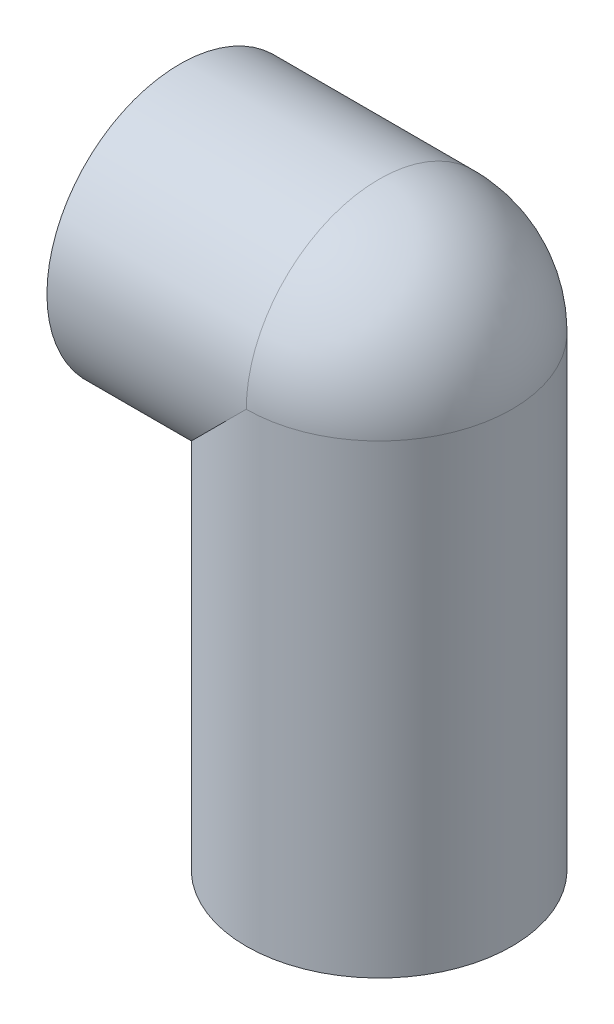
from build123d import *

# Parameters (mm, degrees)
BOSS_EXTRUDE1_DEPTH = 90
FILLET1_R           = 20
SKETCH3_R           = 20
BOSS_EXTRUDE2_DEPTH = 30
BOSS_EXTRUDE3_DEPTH = 70


with BuildPart() as part:
    # Sketch1 → Boss-Extrude1 (new body)
    with BuildSketch(Plane(origin=(0, 110, 0), x_dir=(1, 0, 0), z_dir=(0, 1, 0))):
        with BuildLine():
            Line((60, 20), (60, -20))
            ThreePointArc((60, -20), (80, 0), (60, 20))
        make_face()
    extrude(amount=BOSS_EXTRUDE1_DEPTH)

    # Fillet1
    fillet1_edges = [part.edges().sort_by_distance(p)[0] for p in [
        (80, 200, 0),
    ]]
    fillet(fillet1_edges, radius=FILLET1_R - 0.0001)  # a hair under: the kernel refuses the full size

    # Sketch3 → Boss-Extrude2 (add)
    with BuildSketch(Plane.ZY.offset(-60)):
        with Locations((0, 180)):
            Circle(SKETCH3_R)
    extrude(amount=BOSS_EXTRUDE2_DEPTH)

    # Sketch4 → Boss-Extrude3 (add)
    with BuildSketch(Plane(origin=(0, 110, 0), x_dir=(1, 0, 0), z_dir=(0, 1, 0))):
        with BuildLine():
            Line((60, 20), (60, -20))
            ThreePointArc((60, -20), (40, 0), (60, 20))
        make_face()
    extrude(amount=BOSS_EXTRUDE3_DEPTH)


solid = part.part
